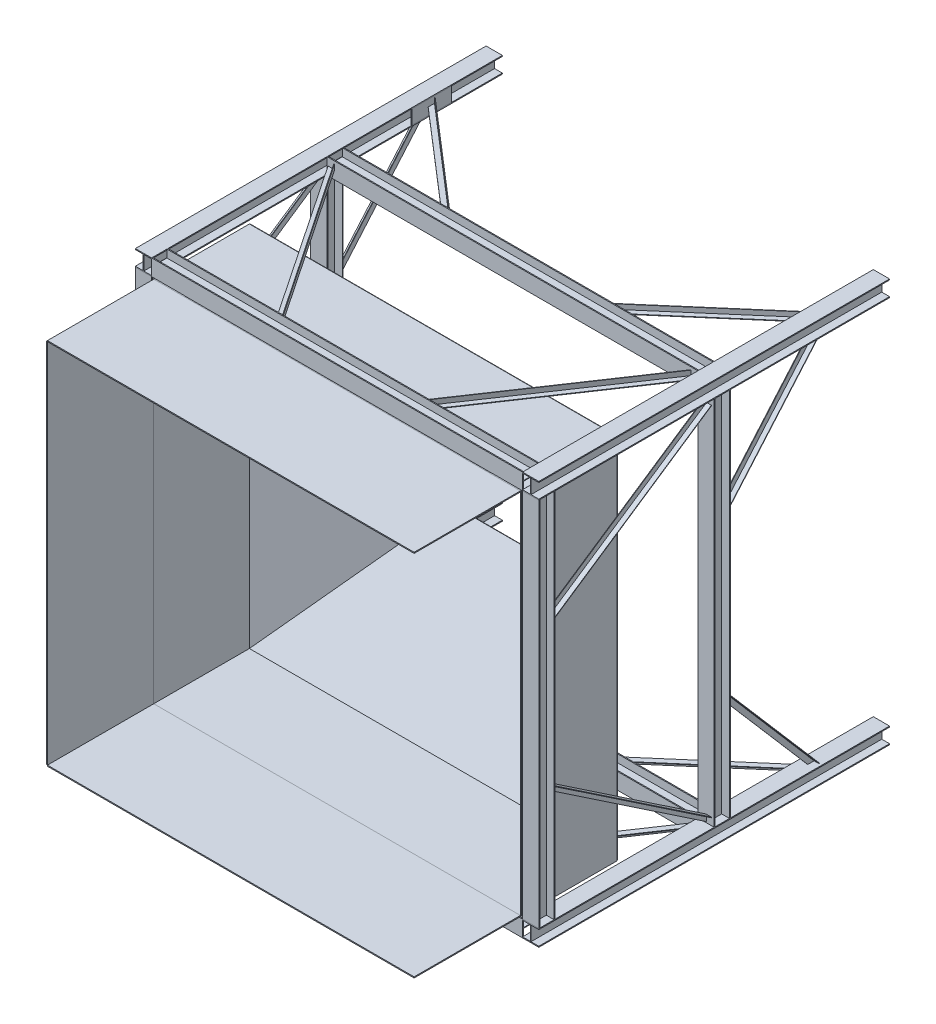
from build123d import *

# Parameters (mm, degrees)
COLUMNA_H_1_DEPTH                            = 3300
COLUMNA_H_2_DEPTH                            = 3300
COLUMNA_H_3_DEPTH                            = 3300
COLUMNA_H_4_DEPTH                            = 3300
VIGA_H_CARGA_1650_DEPTH                      = 3490
VIGA_H_CARGA_3300_DEPTH                      = 3490
CONTORNO_CIERRE_COLUMNA_CARGA_A_W            = 370
CONTORNO_CIERRE_COLUMNA_CARGA_A_H            = 135
CIERRE_COLUMNA_CARGA_A_DEPTH                 = 8
ALA_PLANA_ANGULAR_SUPERIOR_CARGA_A_DEPTH     = 5
RETORNO_ANGULAR_SUPERIOR_CARGA_A_DEPTH       = 45
ALA_PLANA_ANGULAR_INFERIOR_CARGA_A_DEPTH     = 5
RETORNO_ANGULAR_INFERIOR_CARGA_A_DEPTH       = 45
CONTORNO_CIERRE_COLUMNA_CARGA_B_W            = 370
CONTORNO_CIERRE_COLUMNA_CARGA_B_H            = 135
CIERRE_COLUMNA_CARGA_B_DEPTH                 = 8
ALA_PLANA_ANGULAR_SUPERIOR_CARGA_B_DEPTH     = 5
RETORNO_ANGULAR_SUPERIOR_CARGA_B_DEPTH       = 45
ALA_PLANA_ANGULAR_INFERIOR_CARGA_B_DEPTH     = 5
RETORNO_ANGULAR_INFERIOR_CARGA_B_DEPTH       = 45
CONTORNO_ASIENTO_SOLDADO_CARGA_W             = 2900
CONTORNO_ASIENTO_SOLDADO_CARGA_H             = 83.725
ASIENTO_SOLDADO_CARGA_DEPTH                  = 9.525
VIGA_H_FONDO_1650_DEPTH                      = 3490
VIGA_H_FONDO_3300_DEPTH                      = 3490
CONTORNO_CIERRE_COLUMNA_FONDO_A_W            = 370
CONTORNO_CIERRE_COLUMNA_FONDO_A_H            = 135
CIERRE_COLUMNA_FONDO_A_DEPTH                 = 8
ALA_PLANA_ANGULAR_SUPERIOR_FONDO_A_DEPTH     = 5
RETORNO_ANGULAR_SUPERIOR_FONDO_A_DEPTH       = 45
ALA_PLANA_ANGULAR_INFERIOR_FONDO_A_DEPTH     = 5
RETORNO_ANGULAR_INFERIOR_FONDO_A_DEPTH       = 45
CONTORNO_CIERRE_COLUMNA_FONDO_B_W            = 370
CONTORNO_CIERRE_COLUMNA_FONDO_B_H            = 135
CIERRE_COLUMNA_FONDO_B_DEPTH                 = 8
ALA_PLANA_ANGULAR_SUPERIOR_FONDO_B_DEPTH     = 5
RETORNO_ANGULAR_SUPERIOR_FONDO_B_DEPTH       = 45
ALA_PLANA_ANGULAR_INFERIOR_FONDO_B_DEPTH     = 5
RETORNO_ANGULAR_INFERIOR_FONDO_B_DEPTH       = 45
CONTORNO_ASIENTO_SOLDADO_FONDO_W             = 2900
CONTORNO_ASIENTO_SOLDADO_FONDO_H             = 83.725
ASIENTO_SOLDADO_FONDO_DEPTH                  = 9.525
VIGA_H_IZQUIERDA_1650_DEPTH                  = 3490
VIGA_H_IZQUIERDA_3300_DEPTH                  = 3490
ALA_PLANA_ANGULAR_SUPERIOR_IZQUIERDA_A_DEPTH = 5
RETORNO_ANGULAR_SUPERIOR_IZQUIERDA_A_DEPTH   = 45
ALA_PLANA_ANGULAR_INFERIOR_IZQUIERDA_A_DEPTH = 5
RETORNO_ANGULAR_INFERIOR_IZQUIERDA_A_DEPTH   = 45
ALA_PLANA_ANGULAR_SUPERIOR_IZQUIERDA_B_DEPTH = 5
RETORNO_ANGULAR_SUPERIOR_IZQUIERDA_B_DEPTH   = 45
ALA_PLANA_ANGULAR_INFERIOR_IZQUIERDA_B_DEPTH = 5
RETORNO_ANGULAR_INFERIOR_IZQUIERDA_B_DEPTH   = 45
CONTORNO_ASIENTO_SOLDADO_IZQUIERDA_W         = 83.725
CONTORNO_ASIENTO_SOLDADO_IZQUIERDA_H         = 2900
ASIENTO_SOLDADO_IZQUIERDA_DEPTH              = 9.525
VIGA_H_DERECHA_1650_DEPTH                    = 3490
VIGA_H_DERECHA_3300_DEPTH                    = 3490
ALA_PLANA_ANGULAR_SUPERIOR_DERECHA_A_DEPTH   = 5
RETORNO_ANGULAR_SUPERIOR_DERECHA_A_DEPTH     = 45
ALA_PLANA_ANGULAR_INFERIOR_DERECHA_A_DEPTH   = 5
RETORNO_ANGULAR_INFERIOR_DERECHA_A_DEPTH     = 45
ALA_PLANA_ANGULAR_SUPERIOR_DERECHA_B_DEPTH   = 5
RETORNO_ANGULAR_SUPERIOR_DERECHA_B_DEPTH     = 45
ALA_PLANA_ANGULAR_INFERIOR_DERECHA_B_DEPTH   = 5
RETORNO_ANGULAR_INFERIOR_DERECHA_B_DEPTH     = 45
CONTORNO_ASIENTO_SOLDADO_DERECHA_W           = 83.725
CONTORNO_ASIENTO_SOLDADO_DERECHA_H           = 2900
ASIENTO_SOLDADO_DERECHA_DEPTH                = 9.525
CONTORNO_COLLAR_LATERAL_Y_NEGATIVO_W         = 3450
CONTORNO_COLLAR_LATERAL_Y_NEGATIVO_H         = 900
COLLAR_LATERAL_Y_NEGATIVO_DEPTH              = 9.525
CONTORNO_ALER_N_LATERAL_Y_NEGATIVO_W         = 3450
CONTORNO_ALER_N_LATERAL_Y_NEGATIVO_H         = 1000
ALER_N_LATERAL_Y_NEGATIVO_DEPTH              = 9.525
EMBUDO_LATERAL_Y_NEGATIVO_DEPTH              = 9.525
CONTORNO_COLLAR_CARGA_W                      = 900
CONTORNO_COLLAR_CARGA_H                      = 3450
COLLAR_CARGA_DEPTH                           = 9.525
EMBUDO_CARGA_DEPTH                           = 9.525
CONTORNO_COLLAR_LATERAL_Y_POSITIVO_W         = 3450
CONTORNO_COLLAR_LATERAL_Y_POSITIVO_H         = 900
COLLAR_LATERAL_Y_POSITIVO_DEPTH              = 9.525
CONTORNO_ALER_N_LATERAL_Y_POSITIVO_W         = 3450
CONTORNO_ALER_N_LATERAL_Y_POSITIVO_H         = 1000
ALER_N_LATERAL_Y_POSITIVO_DEPTH              = 9.525
EMBUDO_LATERAL_Y_POSITIVO_DEPTH              = 9.525
CONTORNO_COLLAR_FONDO_X_NEGATIVO_W           = 900
CONTORNO_COLLAR_FONDO_X_NEGATIVO_H           = 3450
COLLAR_FONDO_X_NEGATIVO_DEPTH                = 9.525
CONTORNO_ALER_N_FONDO_X_NEGATIVO_W           = 1000
CONTORNO_ALER_N_FONDO_X_NEGATIVO_H           = 3450
ALER_N_FONDO_X_NEGATIVO_DEPTH                = 9.525
EMBUDO_FONDO_X_NEGATIVO_DEPTH                = 9.525


with BuildPart() as part:
    # Contorno Columna H 1 → Columna H 1 (new body)
    with BuildSketch(Plane.XY):
        Polygon((-1898, -1898), (-1745, -1898), (-1745, -1889), (-1818.25, -1889), (-1818.25, -1754), (-1745, -1754), (-1745, -1745), (-1898, -1745), (-1898, -1754), (-1824.75, -1754), (-1824.75, -1889), (-1898, -1889), align=None)
    extrude(amount=COLUMNA_H_1_DEPTH)


with BuildPart() as body_2:
    # Contorno Columna H 2 → Columna H 2 (new body)
    with BuildSketch(Plane.XY):
        Polygon((-1898, 1745), (-1745, 1745), (-1745, 1754), (-1818.25, 1754), (-1818.25, 1889), (-1745, 1889), (-1745, 1898), (-1898, 1898), (-1898, 1889), (-1824.75, 1889), (-1824.75, 1754), (-1898, 1754), align=None)
    extrude(amount=COLUMNA_H_2_DEPTH)


with BuildPart() as body_3:
    # Contorno Columna H 3 → Columna H 3 (new body)
    with BuildSketch(Plane.XY):
        Polygon((1745, -1898), (1898, -1898), (1898, -1889), (1824.75, -1889), (1824.75, -1754), (1898, -1754), (1898, -1745), (1745, -1745), (1745, -1754), (1818.25, -1754), (1818.25, -1889), (1745, -1889), align=None)
    extrude(amount=COLUMNA_H_3_DEPTH)


with BuildPart() as body_4:
    # Contorno Columna H 4 → Columna H 4 (new body)
    with BuildSketch(Plane.XY):
        Polygon((1745, 1745), (1898, 1745), (1898, 1754), (1824.75, 1754), (1824.75, 1889), (1898, 1889), (1898, 1898), (1745, 1898), (1745, 1889), (1818.25, 1889), (1818.25, 1754), (1745, 1754), align=None)
    extrude(amount=COLUMNA_H_4_DEPTH)


with BuildPart() as body_5:
    # Contorno Viga H carga 1650 → Viga H carga 1650 (new body)
    with BuildSketch(Plane(origin=(-1745, 0, 0), x_dir=(0, 0, -1), z_dir=(1, 0, 0))):
        Polygon((-1497, -1745), (-1497, -1898), (-1506, -1898), (-1506, -1824.75), (-1641, -1824.75), (-1641, -1898), (-1650, -1898), (-1650, -1745), (-1641, -1745), (-1641, -1818.25), (-1506, -1818.25), (-1506, -1745), align=None)
    extrude(amount=VIGA_H_CARGA_1650_DEPTH)


with BuildPart() as body_6:
    # Contorno Viga H carga 3300 → Viga H carga 3300 (new body)
    with BuildSketch(Plane(origin=(-1745, 0, 0), x_dir=(0, 0, -1), z_dir=(1, 0, 0))):
        Polygon((-3147, -1745), (-3147, -1898), (-3156, -1898), (-3156, -1824.75), (-3291, -1824.75), (-3291, -1898), (-3300, -1898), (-3300, -1745), (-3291, -1745), (-3291, -1818.25), (-3156, -1818.25), (-3156, -1745), align=None)
    extrude(amount=VIGA_H_CARGA_3300_DEPTH)


with BuildPart() as body_7:
    # Contorno Cierre columna carga A → Cierre columna carga A (new body)
    with BuildSketch(Plane(origin=(-1745, 0, 0), x_dir=(0, 0, -1), z_dir=(1, 0, 0))):
        with Locations((-665, -1821.5)):
            Rectangle(CONTORNO_CIERRE_COLUMNA_CARGA_A_W, CONTORNO_CIERRE_COLUMNA_CARGA_A_H)
    extrude(amount=-CIERRE_COLUMNA_CARGA_A_DEPTH)


with BuildPart() as body_8:
    # Contorno Ala plana Angular superior carg → Ala plana Angular superior carga A (new body)
    with BuildSketch(Plane(origin=(0, -1821.5, 0), x_dir=(1, 0, 0), z_dir=(0, 1, 0))):
        Polygon((-1674.870108064, -1650), (-1735.129891936, -1650), (-728.129891936, -3147), (-667.870108064, -3147), align=None)
    extrude(amount=-ALA_PLANA_ANGULAR_SUPERIOR_CARGA_A_DEPTH)


with BuildPart() as body_9:
    # Contorno Retorno Angular superior carga → Retorno Angular superior carga A (new body)
    with BuildSketch(Plane(origin=(0, -1826.5, 0), x_dir=(1, 0, 0), z_dir=(0, 1, 0))):
        Polygon((-1674.870108064, -1650), (-1680.896086451, -1650), (-673.896086451, -3147), (-667.870108064, -3147), align=None)
    extrude(amount=-RETORNO_ANGULAR_SUPERIOR_CARGA_A_DEPTH)


with BuildPart() as body_8_1:
    add(body_8.part)

    # Angular superior carga A: union body 9
    add(body_9.part)


with BuildPart() as body_9_2:
    # Contorno Ala plana Angular inferior carg → Ala plana Angular inferior carga A (new body)
    with BuildSketch(Plane(origin=(0, -1821.5, 0), x_dir=(1, 0, 0), z_dir=(0, 1, 0))):
        Polygon((-1745, -631.991026401), (-1745, -698.008973599), (-818.285648465, -1497), (-741.714351535, -1497), align=None)
    extrude(amount=-ALA_PLANA_ANGULAR_INFERIOR_CARGA_A_DEPTH)


with BuildPart() as body_10:
    # Contorno Retorno Angular inferior carga → Retorno Angular inferior carga A (new body)
    with BuildSketch(Plane(origin=(0, -1826.5, 0), x_dir=(1, 0, 0), z_dir=(0, 1, 0))):
        Polygon((-1745, -631.991026401), (-1745, -638.592821121), (-749.371481228, -1497), (-741.714351535, -1497), align=None)
    extrude(amount=-RETORNO_ANGULAR_INFERIOR_CARGA_A_DEPTH)


with BuildPart() as body_9_2_1:
    add(body_9_2.part)

    # Angular inferior carga A: union body 10
    add(body_10.part)


with BuildPart() as body_10_2:
    # Contorno Cierre columna carga B → Cierre columna carga B (new body)
    with BuildSketch(Plane(origin=(1745, 0, 0), x_dir=(0, 0, -1), z_dir=(1, 0, 0))):
        with Locations((-665, -1821.5)):
            Rectangle(CONTORNO_CIERRE_COLUMNA_CARGA_B_W, CONTORNO_CIERRE_COLUMNA_CARGA_B_H)
    extrude(amount=CIERRE_COLUMNA_CARGA_B_DEPTH)


with BuildPart() as body_11:
    # Contorno Ala plana Angular superior  2 → Ala plana Angular superior carga B (new body)
    with BuildSketch(Plane(origin=(0, -1821.5, 0), x_dir=(1, 0, 0), z_dir=(0, 1, 0))):
        Polygon((1674.870108064, -1650), (1735.129891936, -1650), (728.129891936, -3147), (667.870108064, -3147), align=None)
    extrude(amount=-ALA_PLANA_ANGULAR_SUPERIOR_CARGA_B_DEPTH)


with BuildPart() as body_12:
    # Contorno Retorno Angular superior ca 2 → Retorno Angular superior carga B (new body)
    with BuildSketch(Plane(origin=(0, -1826.5, 0), x_dir=(1, 0, 0), z_dir=(0, 1, 0))):
        Polygon((1674.870108064, -1650), (1680.896086451, -1650), (673.896086451, -3147), (667.870108064, -3147), align=None)
    extrude(amount=-RETORNO_ANGULAR_SUPERIOR_CARGA_B_DEPTH)


with BuildPart() as body_11_1:
    add(body_11.part)

    # Angular superior carga B: union body 12
    add(body_12.part)


with BuildPart() as body_12_2:
    # Contorno Ala plana Angular inferior  2 → Ala plana Angular inferior carga B (new body)
    with BuildSketch(Plane(origin=(0, -1821.5, 0), x_dir=(1, 0, 0), z_dir=(0, 1, 0))):
        Polygon((1745, -631.991026401), (1745, -698.008973599), (818.285648465, -1497), (741.714351535, -1497), align=None)
    extrude(amount=-ALA_PLANA_ANGULAR_INFERIOR_CARGA_B_DEPTH)


with BuildPart() as body_13:
    # Contorno Retorno Angular inferior ca 2 → Retorno Angular inferior carga B (new body)
    with BuildSketch(Plane(origin=(0, -1826.5, 0), x_dir=(1, 0, 0), z_dir=(0, 1, 0))):
        Polygon((1745, -631.991026401), (1745, -638.592821121), (749.371481228, -1497), (741.714351535, -1497), align=None)
    extrude(amount=-RETORNO_ANGULAR_INFERIOR_CARGA_B_DEPTH)


with BuildPart() as body_12_2_1:
    add(body_12_2.part)

    # Angular inferior carga B: union body 13
    add(body_13.part)


with BuildPart() as body_13_2:
    # Contorno Asiento soldado carga → Asiento soldado carga (new body)
    with BuildSketch(Plane.XY.offset(3281.475)):
        with Locations((0, -1776.3875)):
            Rectangle(CONTORNO_ASIENTO_SOLDADO_CARGA_W, CONTORNO_ASIENTO_SOLDADO_CARGA_H)
    extrude(amount=ASIENTO_SOLDADO_CARGA_DEPTH)


with BuildPart() as body_14:
    # Contorno Viga H fondo 1650 → Viga H fondo 1650 (new body)
    with BuildSketch(Plane(origin=(-1745, 0, 0), x_dir=(0, 0, -1), z_dir=(1, 0, 0))):
        Polygon((-1497, 1745), (-1497, 1898), (-1506, 1898), (-1506, 1824.75), (-1641, 1824.75), (-1641, 1898), (-1650, 1898), (-1650, 1745), (-1641, 1745), (-1641, 1818.25), (-1506, 1818.25), (-1506, 1745), align=None)
    extrude(amount=VIGA_H_FONDO_1650_DEPTH)


with BuildPart() as body_15:
    # Contorno Viga H fondo 3300 → Viga H fondo 3300 (new body)
    with BuildSketch(Plane(origin=(-1745, 0, 0), x_dir=(0, 0, -1), z_dir=(1, 0, 0))):
        Polygon((-3147, 1745), (-3147, 1898), (-3156, 1898), (-3156, 1824.75), (-3291, 1824.75), (-3291, 1898), (-3300, 1898), (-3300, 1745), (-3291, 1745), (-3291, 1818.25), (-3156, 1818.25), (-3156, 1745), align=None)
    extrude(amount=VIGA_H_FONDO_3300_DEPTH)


with BuildPart() as body_16:
    # Contorno Cierre columna fondo A → Cierre columna fondo A (new body)
    with BuildSketch(Plane(origin=(-1745, 0, 0), x_dir=(0, 0, -1), z_dir=(1, 0, 0))):
        with Locations((-665, 1821.5)):
            Rectangle(CONTORNO_CIERRE_COLUMNA_FONDO_A_W, CONTORNO_CIERRE_COLUMNA_FONDO_A_H)
    extrude(amount=-CIERRE_COLUMNA_FONDO_A_DEPTH)


with BuildPart() as body_17:
    # Contorno Ala plana Angular superior fond → Ala plana Angular superior fondo A (new body)
    with BuildSketch(Plane(origin=(0, 1821.5, 0), x_dir=(1, 0, 0), z_dir=(0, 1, 0))):
        Polygon((-1674.870108064, -1650), (-1735.129891936, -1650), (-728.129891936, -3147), (-667.870108064, -3147), align=None)
    extrude(amount=ALA_PLANA_ANGULAR_SUPERIOR_FONDO_A_DEPTH)


with BuildPart() as body_18:
    # Contorno Retorno Angular superior fondo → Retorno Angular superior fondo A (new body)
    with BuildSketch(Plane(origin=(0, 1826.5, 0), x_dir=(1, 0, 0), z_dir=(0, 1, 0))):
        Polygon((-1674.870108064, -1650), (-1680.896086451, -1650), (-673.896086451, -3147), (-667.870108064, -3147), align=None)
    extrude(amount=RETORNO_ANGULAR_SUPERIOR_FONDO_A_DEPTH)


with BuildPart() as body_17_1:
    add(body_17.part)

    # Angular superior fondo A: union body 18
    add(body_18.part)


with BuildPart() as body_18_2:
    # Contorno Ala plana Angular inferior fond → Ala plana Angular inferior fondo A (new body)
    with BuildSketch(Plane(origin=(0, 1821.5, 0), x_dir=(1, 0, 0), z_dir=(0, 1, 0))):
        Polygon((-1745, -631.991026401), (-1745, -698.008973599), (-818.285648465, -1497), (-741.714351535, -1497), align=None)
    extrude(amount=ALA_PLANA_ANGULAR_INFERIOR_FONDO_A_DEPTH)


with BuildPart() as body_19:
    # Contorno Retorno Angular inferior fondo → Retorno Angular inferior fondo A (new body)
    with BuildSketch(Plane(origin=(0, 1826.5, 0), x_dir=(1, 0, 0), z_dir=(0, 1, 0))):
        Polygon((-1745, -631.991026401), (-1745, -638.592821121), (-749.371481228, -1497), (-741.714351535, -1497), align=None)
    extrude(amount=RETORNO_ANGULAR_INFERIOR_FONDO_A_DEPTH)


with BuildPart() as body_18_2_1:
    add(body_18_2.part)

    # Angular inferior fondo A: union body 19
    add(body_19.part)


with BuildPart() as body_19_2:
    # Contorno Cierre columna fondo B → Cierre columna fondo B (new body)
    with BuildSketch(Plane(origin=(1745, 0, 0), x_dir=(0, 0, -1), z_dir=(1, 0, 0))):
        with Locations((-665, 1821.5)):
            Rectangle(CONTORNO_CIERRE_COLUMNA_FONDO_B_W, CONTORNO_CIERRE_COLUMNA_FONDO_B_H)
    extrude(amount=CIERRE_COLUMNA_FONDO_B_DEPTH)


with BuildPart() as body_20:
    # Contorno Ala plana Angular superior  3 → Ala plana Angular superior fondo B (new body)
    with BuildSketch(Plane(origin=(0, 1821.5, 0), x_dir=(1, 0, 0), z_dir=(0, 1, 0))):
        Polygon((1674.870108064, -1650), (1735.129891936, -1650), (728.129891936, -3147), (667.870108064, -3147), align=None)
    extrude(amount=ALA_PLANA_ANGULAR_SUPERIOR_FONDO_B_DEPTH)


with BuildPart() as body_21:
    # Contorno Retorno Angular superior fo 2 → Retorno Angular superior fondo B (new body)
    with BuildSketch(Plane(origin=(0, 1826.5, 0), x_dir=(1, 0, 0), z_dir=(0, 1, 0))):
        Polygon((1674.870108064, -1650), (1680.896086451, -1650), (673.896086451, -3147), (667.870108064, -3147), align=None)
    extrude(amount=RETORNO_ANGULAR_SUPERIOR_FONDO_B_DEPTH)


with BuildPart() as body_20_1:
    add(body_20.part)

    # Angular superior fondo B: union body 21
    add(body_21.part)


with BuildPart() as body_21_2:
    # Contorno Ala plana Angular inferior  3 → Ala plana Angular inferior fondo B (new body)
    with BuildSketch(Plane(origin=(0, 1821.5, 0), x_dir=(1, 0, 0), z_dir=(0, 1, 0))):
        Polygon((1745, -631.991026401), (1745, -698.008973599), (818.285648465, -1497), (741.714351535, -1497), align=None)
    extrude(amount=ALA_PLANA_ANGULAR_INFERIOR_FONDO_B_DEPTH)


with BuildPart() as body_22:
    # Contorno Retorno Angular inferior fo 2 → Retorno Angular inferior fondo B (new body)
    with BuildSketch(Plane(origin=(0, 1826.5, 0), x_dir=(1, 0, 0), z_dir=(0, 1, 0))):
        Polygon((1745, -631.991026401), (1745, -638.592821121), (749.371481228, -1497), (741.714351535, -1497), align=None)
    extrude(amount=RETORNO_ANGULAR_INFERIOR_FONDO_B_DEPTH)


with BuildPart() as body_21_2_1:
    add(body_21_2.part)

    # Angular inferior fondo B: union body 22
    add(body_22.part)


with BuildPart() as body_22_2:
    # Contorno Asiento soldado fondo → Asiento soldado fondo (new body)
    with BuildSketch(Plane.XY.offset(3281.475)):
        with Locations((0, 1776.3875)):
            Rectangle(CONTORNO_ASIENTO_SOLDADO_FONDO_W, CONTORNO_ASIENTO_SOLDADO_FONDO_H)
    extrude(amount=ASIENTO_SOLDADO_FONDO_DEPTH)


with BuildPart() as body_23:
    # Contorno Viga H izquierda 1650 → Viga H izquierda 1650 (new body)
    with BuildSketch(Plane(origin=(0, -1745, 0), x_dir=(1, 0, 0), z_dir=(0, 1, 0))):
        Polygon((-1745, -1497), (-1898, -1497), (-1898, -1506), (-1824.75, -1506), (-1824.75, -1641), (-1898, -1641), (-1898, -1650), (-1745, -1650), (-1745, -1641), (-1818.25, -1641), (-1818.25, -1506), (-1745, -1506), align=None)
    extrude(amount=VIGA_H_IZQUIERDA_1650_DEPTH)


with BuildPart() as body_24:
    # Contorno Viga H izquierda 3300 → Viga H izquierda 3300 (new body)
    with BuildSketch(Plane(origin=(0, -1745, 0), x_dir=(1, 0, 0), z_dir=(0, 1, 0))):
        Polygon((-1745, -3147), (-1898, -3147), (-1898, -3156), (-1824.75, -3156), (-1824.75, -3291), (-1898, -3291), (-1898, -3300), (-1745, -3300), (-1745, -3291), (-1818.25, -3291), (-1818.25, -3156), (-1745, -3156), align=None)
    extrude(amount=VIGA_H_IZQUIERDA_3300_DEPTH)


with BuildPart() as body_25:
    # Contorno Ala plana Angular superior izqu → Ala plana Angular superior izquierda A (new body)
    with BuildSketch(Plane(origin=(-1821.5, 0, 0), x_dir=(0, 0, -1), z_dir=(1, 0, 0))):
        Polygon((-1650, -1674.870108064), (-1650, -1735.129891936), (-3147, -728.129891936), (-3147, -667.870108064), align=None)
    extrude(amount=-ALA_PLANA_ANGULAR_SUPERIOR_IZQUIERDA_A_DEPTH)


with BuildPart() as body_26:
    # Contorno Retorno Angular superior izquie → Retorno Angular superior izquierda A (new body)
    with BuildSketch(Plane(origin=(-1826.5, 0, 0), x_dir=(0, 0, -1), z_dir=(1, 0, 0))):
        Polygon((-1650, -1674.870108064), (-1650, -1680.896086451), (-3147, -673.896086451), (-3147, -667.870108064), align=None)
    extrude(amount=-RETORNO_ANGULAR_SUPERIOR_IZQUIERDA_A_DEPTH)


with BuildPart() as body_25_1:
    add(body_25.part)

    # Angular superior izquierda A: union body 26
    add(body_26.part)


with BuildPart() as body_26_2:
    # Contorno Ala plana Angular inferior izqu → Ala plana Angular inferior izquierda A (new body)
    with BuildSketch(Plane(origin=(-1821.5, 0, 0), x_dir=(0, 0, -1), z_dir=(1, 0, 0))):
        Polygon((-631.991026401, -1745), (-698.008973599, -1745), (-1497, -818.285648465), (-1497, -741.714351535), align=None)
    extrude(amount=-ALA_PLANA_ANGULAR_INFERIOR_IZQUIERDA_A_DEPTH)


with BuildPart() as body_27:
    # Contorno Retorno Angular inferior izquie → Retorno Angular inferior izquierda A (new body)
    with BuildSketch(Plane(origin=(-1826.5, 0, 0), x_dir=(0, 0, -1), z_dir=(1, 0, 0))):
        Polygon((-631.991026401, -1745), (-638.592821121, -1745), (-1497, -749.371481228), (-1497, -741.714351535), align=None)
    extrude(amount=-RETORNO_ANGULAR_INFERIOR_IZQUIERDA_A_DEPTH)


with BuildPart() as body_26_2_1:
    add(body_26_2.part)

    # Angular inferior izquierda A: union body 27
    add(body_27.part)


with BuildPart() as body_27_2:
    # Contorno Ala plana Angular superior  4 → Ala plana Angular superior izquierda B (new body)
    with BuildSketch(Plane(origin=(-1821.5, 0, 0), x_dir=(0, 0, -1), z_dir=(1, 0, 0))):
        Polygon((-1650, 1674.870108064), (-1650, 1735.129891936), (-3147, 728.129891936), (-3147, 667.870108064), align=None)
    extrude(amount=-ALA_PLANA_ANGULAR_SUPERIOR_IZQUIERDA_B_DEPTH)


with BuildPart() as body_28:
    # Contorno Retorno Angular superior iz 2 → Retorno Angular superior izquierda B (new body)
    with BuildSketch(Plane(origin=(-1826.5, 0, 0), x_dir=(0, 0, -1), z_dir=(1, 0, 0))):
        Polygon((-1650, 1674.870108064), (-1650, 1680.896086451), (-3147, 673.896086451), (-3147, 667.870108064), align=None)
    extrude(amount=-RETORNO_ANGULAR_SUPERIOR_IZQUIERDA_B_DEPTH)


with BuildPart() as body_27_2_1:
    add(body_27_2.part)

    # Angular superior izquierda B: union body 28
    add(body_28.part)


with BuildPart() as body_28_2:
    # Contorno Ala plana Angular inferior  4 → Ala plana Angular inferior izquierda B (new body)
    with BuildSketch(Plane(origin=(-1821.5, 0, 0), x_dir=(0, 0, -1), z_dir=(1, 0, 0))):
        Polygon((-631.991026401, 1745), (-698.008973599, 1745), (-1497, 818.285648465), (-1497, 741.714351535), align=None)
    extrude(amount=-ALA_PLANA_ANGULAR_INFERIOR_IZQUIERDA_B_DEPTH)


with BuildPart() as body_29:
    # Contorno Retorno Angular inferior iz 2 → Retorno Angular inferior izquierda B (new body)
    with BuildSketch(Plane(origin=(-1826.5, 0, 0), x_dir=(0, 0, -1), z_dir=(1, 0, 0))):
        Polygon((-631.991026401, 1745), (-638.592821121, 1745), (-1497, 749.371481228), (-1497, 741.714351535), align=None)
    extrude(amount=-RETORNO_ANGULAR_INFERIOR_IZQUIERDA_B_DEPTH)


with BuildPart() as body_28_2_1:
    add(body_28_2.part)

    # Angular inferior izquierda B: union body 29
    add(body_29.part)


with BuildPart() as body_29_2:
    # Contorno Asiento soldado izquierda → Asiento soldado izquierda (new body)
    with BuildSketch(Plane.XY.offset(3281.475)):
        with Locations((-1776.3875, 0)):
            Rectangle(CONTORNO_ASIENTO_SOLDADO_IZQUIERDA_W, CONTORNO_ASIENTO_SOLDADO_IZQUIERDA_H)
    extrude(amount=ASIENTO_SOLDADO_IZQUIERDA_DEPTH)


with BuildPart() as body_30:
    # Contorno Viga H derecha 1650 → Viga H derecha 1650 (new body)
    with BuildSketch(Plane(origin=(0, -1745, 0), x_dir=(1, 0, 0), z_dir=(0, 1, 0))):
        Polygon((1745, -1497), (1898, -1497), (1898, -1506), (1824.75, -1506), (1824.75, -1641), (1898, -1641), (1898, -1650), (1745, -1650), (1745, -1641), (1818.25, -1641), (1818.25, -1506), (1745, -1506), align=None)
    extrude(amount=VIGA_H_DERECHA_1650_DEPTH)


with BuildPart() as body_31:
    # Contorno Viga H derecha 3300 → Viga H derecha 3300 (new body)
    with BuildSketch(Plane(origin=(0, -1745, 0), x_dir=(1, 0, 0), z_dir=(0, 1, 0))):
        Polygon((1745, -3147), (1898, -3147), (1898, -3156), (1824.75, -3156), (1824.75, -3291), (1898, -3291), (1898, -3300), (1745, -3300), (1745, -3291), (1818.25, -3291), (1818.25, -3156), (1745, -3156), align=None)
    extrude(amount=VIGA_H_DERECHA_3300_DEPTH)


with BuildPart() as body_32:
    # Contorno Ala plana Angular superior dere → Ala plana Angular superior derecha A (new body)
    with BuildSketch(Plane(origin=(1821.5, 0, 0), x_dir=(0, 0, -1), z_dir=(1, 0, 0))):
        Polygon((-1650, -1674.870108064), (-1650, -1735.129891936), (-3147, -728.129891936), (-3147, -667.870108064), align=None)
    extrude(amount=ALA_PLANA_ANGULAR_SUPERIOR_DERECHA_A_DEPTH)


with BuildPart() as body_33:
    # Contorno Retorno Angular superior derech → Retorno Angular superior derecha A (new body)
    with BuildSketch(Plane(origin=(1826.5, 0, 0), x_dir=(0, 0, -1), z_dir=(1, 0, 0))):
        Polygon((-1650, -1674.870108064), (-1650, -1680.896086451), (-3147, -673.896086451), (-3147, -667.870108064), align=None)
    extrude(amount=RETORNO_ANGULAR_SUPERIOR_DERECHA_A_DEPTH)


with BuildPart() as body_32_1:
    add(body_32.part)

    # Angular superior derecha A: union body 33
    add(body_33.part)


with BuildPart() as body_33_2:
    # Contorno Ala plana Angular inferior dere → Ala plana Angular inferior derecha A (new body)
    with BuildSketch(Plane(origin=(1821.5, 0, 0), x_dir=(0, 0, -1), z_dir=(1, 0, 0))):
        Polygon((-631.991026401, -1745), (-698.008973599, -1745), (-1497, -818.285648465), (-1497, -741.714351535), align=None)
    extrude(amount=ALA_PLANA_ANGULAR_INFERIOR_DERECHA_A_DEPTH)


with BuildPart() as body_34:
    # Contorno Retorno Angular inferior derech → Retorno Angular inferior derecha A (new body)
    with BuildSketch(Plane(origin=(1826.5, 0, 0), x_dir=(0, 0, -1), z_dir=(1, 0, 0))):
        Polygon((-631.991026401, -1745), (-638.592821121, -1745), (-1497, -749.371481228), (-1497, -741.714351535), align=None)
    extrude(amount=RETORNO_ANGULAR_INFERIOR_DERECHA_A_DEPTH)


with BuildPart() as body_33_2_1:
    add(body_33_2.part)

    # Angular inferior derecha A: union body 34
    add(body_34.part)


with BuildPart() as body_34_2:
    # Contorno Ala plana Angular superior  5 → Ala plana Angular superior derecha B (new body)
    with BuildSketch(Plane(origin=(1821.5, 0, 0), x_dir=(0, 0, -1), z_dir=(1, 0, 0))):
        Polygon((-1650, 1674.870108064), (-1650, 1735.129891936), (-3147, 728.129891936), (-3147, 667.870108064), align=None)
    extrude(amount=ALA_PLANA_ANGULAR_SUPERIOR_DERECHA_B_DEPTH)


with BuildPart() as body_35:
    # Contorno Retorno Angular superior de 2 → Retorno Angular superior derecha B (new body)
    with BuildSketch(Plane(origin=(1826.5, 0, 0), x_dir=(0, 0, -1), z_dir=(1, 0, 0))):
        Polygon((-1650, 1674.870108064), (-1650, 1680.896086451), (-3147, 673.896086451), (-3147, 667.870108064), align=None)
    extrude(amount=RETORNO_ANGULAR_SUPERIOR_DERECHA_B_DEPTH)


with BuildPart() as body_34_2_1:
    add(body_34_2.part)

    # Angular superior derecha B: union body 35
    add(body_35.part)


with BuildPart() as body_35_2:
    # Contorno Ala plana Angular inferior  5 → Ala plana Angular inferior derecha B (new body)
    with BuildSketch(Plane(origin=(1821.5, 0, 0), x_dir=(0, 0, -1), z_dir=(1, 0, 0))):
        Polygon((-631.991026401, 1745), (-698.008973599, 1745), (-1497, 818.285648465), (-1497, 741.714351535), align=None)
    extrude(amount=ALA_PLANA_ANGULAR_INFERIOR_DERECHA_B_DEPTH)


with BuildPart() as body_36:
    # Contorno Retorno Angular inferior de 2 → Retorno Angular inferior derecha B (new body)
    with BuildSketch(Plane(origin=(1826.5, 0, 0), x_dir=(0, 0, -1), z_dir=(1, 0, 0))):
        Polygon((-631.991026401, 1745), (-638.592821121, 1745), (-1497, 749.371481228), (-1497, 741.714351535), align=None)
    extrude(amount=RETORNO_ANGULAR_INFERIOR_DERECHA_B_DEPTH)


with BuildPart() as body_35_2_1:
    add(body_35_2.part)

    # Angular inferior derecha B: union body 36
    add(body_36.part)


with BuildPart() as body_36_2:
    # Contorno Asiento soldado derecha → Asiento soldado derecha (new body)
    with BuildSketch(Plane.XY.offset(3281.475)):
        with Locations((1776.3875, 0)):
            Rectangle(CONTORNO_ASIENTO_SOLDADO_DERECHA_W, CONTORNO_ASIENTO_SOLDADO_DERECHA_H)
    extrude(amount=ASIENTO_SOLDADO_DERECHA_DEPTH)


with BuildPart() as body_37:
    # Contorno Collar lateral Y negativo → Collar lateral Y negativo (new body)
    with BuildSketch(Plane(origin=(0, -1725, 0), x_dir=(1, 0, 0), z_dir=(0, 1, 0))):
        with Locations((0, -2850)):
            Rectangle(CONTORNO_COLLAR_LATERAL_Y_NEGATIVO_W, CONTORNO_COLLAR_LATERAL_Y_NEGATIVO_H)
    extrude(amount=-COLLAR_LATERAL_Y_NEGATIVO_DEPTH)


with BuildPart() as body_38:
    # Contorno Alerón lateral Y negativo → Alerón lateral Y negativo (new body)
    with BuildSketch(Plane(origin=(0, -1725, 0), x_dir=(1, 0, 0), z_dir=(0, 1, 0))):
        with Locations((0, -3800)):
            Rectangle(CONTORNO_ALER_N_LATERAL_Y_NEGATIVO_W, CONTORNO_ALER_N_LATERAL_Y_NEGATIVO_H)
    extrude(amount=-ALER_N_LATERAL_Y_NEGATIVO_DEPTH)


with BuildPart() as body_39:
    # Contorno Embudo lateral Y negativo → Embudo lateral Y negativo (new body)
    with BuildSketch(Plane(origin=(0, 601.095747456, 995.564831724), x_dir=(1, 0, 0), z_dir=(0, 0.5168690990339176, 0.8560644452749256))):
        Polygon((-1725, -2717.197005781), (1725, -2717.197005781), (600, -1169.416336564), (-600, -1169.416336564), align=None)
    extrude(amount=-EMBUDO_LATERAL_Y_NEGATIVO_DEPTH)


with BuildPart() as body_40:
    # Contorno Collar carga → Collar carga (new body)
    with BuildSketch(Plane(origin=(1725, 0, 0), x_dir=(0, 0, -1), z_dir=(1, 0, 0))):
        with Locations((-2850, 0)):
            Rectangle(CONTORNO_COLLAR_CARGA_W, CONTORNO_COLLAR_CARGA_H)
    extrude(amount=COLLAR_CARGA_DEPTH)


with BuildPart() as body_41:
    # Contorno Embudo carga → Embudo carga (new body)
    with BuildSketch(Plane(origin=(-554.148901279, 0, 779.271892424), x_dir=(-0.814955324568755, 0, -0.5795237863600037), z_dir=(0.5795237863600037, 0, -0.814955324568755))):
        Polygon((-2796.655022145, -1725), (-2796.655022145, 1725), (-1416.211252917, 400), (-1416.211252917, -400), align=None)
    extrude(amount=EMBUDO_CARGA_DEPTH)


with BuildPart() as body_42:
    # Contorno Collar lateral Y positivo → Collar lateral Y positivo (new body)
    with BuildSketch(Plane(origin=(0, 1725, 0), x_dir=(1, 0, 0), z_dir=(0, 1, 0))):
        with Locations((0, -2850)):
            Rectangle(CONTORNO_COLLAR_LATERAL_Y_POSITIVO_W, CONTORNO_COLLAR_LATERAL_Y_POSITIVO_H)
    extrude(amount=COLLAR_LATERAL_Y_POSITIVO_DEPTH)


with BuildPart() as body_43:
    # Contorno Alerón lateral Y positivo → Alerón lateral Y positivo (new body)
    with BuildSketch(Plane(origin=(0, 1725, 0), x_dir=(1, 0, 0), z_dir=(0, 1, 0))):
        with Locations((0, -3800)):
            Rectangle(CONTORNO_ALER_N_LATERAL_Y_POSITIVO_W, CONTORNO_ALER_N_LATERAL_Y_POSITIVO_H)
    extrude(amount=ALER_N_LATERAL_Y_POSITIVO_DEPTH)


with BuildPart() as body_44:
    # Contorno Embudo lateral Y positivo → Embudo lateral Y positivo (new body)
    with BuildSketch(Plane(origin=(0, -601.095747456, 995.564831724), x_dir=(-1, 0, 0), z_dir=(0, 0.5168690990339176, -0.8560644452749256))):
        Polygon((-1725, 2717.197005781), (1725, 2717.197005781), (600, 1169.416336564), (-600, 1169.416336564), align=None)
    extrude(amount=EMBUDO_LATERAL_Y_POSITIVO_DEPTH)


with BuildPart() as body_45:
    # Contorno Collar fondo X negativo → Collar fondo X negativo (new body)
    with BuildSketch(Plane(origin=(-1725, 0, 0), x_dir=(0, 0, -1), z_dir=(1, 0, 0))):
        with Locations((-2850, 0)):
            Rectangle(CONTORNO_COLLAR_FONDO_X_NEGATIVO_W, CONTORNO_COLLAR_FONDO_X_NEGATIVO_H)
    extrude(amount=-COLLAR_FONDO_X_NEGATIVO_DEPTH)


with BuildPart() as body_46:
    # Contorno Alerón fondo X negativo → Alerón fondo X negativo (new body)
    with BuildSketch(Plane(origin=(-1725, 0, 0), x_dir=(0, 0, -1), z_dir=(1, 0, 0))):
        with Locations((-3800, 0)):
            Rectangle(CONTORNO_ALER_N_FONDO_X_NEGATIVO_W, CONTORNO_ALER_N_FONDO_X_NEGATIVO_H)
    extrude(amount=-ALER_N_FONDO_X_NEGATIVO_DEPTH)


with BuildPart() as body_47:
    # Contorno Embudo fondo X negativo → Embudo fondo X negativo (new body)
    with BuildSketch(Plane(origin=(554.148901279, 0, 779.271892424), x_dir=(0.8149553245687554, 0, -0.5795237863600032), z_dir=(0.5795237863600031, 0, 0.8149553245687553))):
        Polygon((-2796.655022145, 1725), (-2796.655022145, -1725), (-1416.211252917, -400), (-1416.211252917, 400), align=None)
    extrude(amount=-EMBUDO_FONDO_X_NEGATIVO_DEPTH)


solid = Compound([part.part, body_2.part, body_3.part, body_4.part, body_5.part, body_6.part, body_7.part, body_8_1.part, body_9_2_1.part, body_10_2.part, body_11_1.part, body_12_2_1.part, body_13_2.part, body_14.part, body_15.part, body_16.part, body_17_1.part, body_18_2_1.part, body_19_2.part, body_20_1.part, body_21_2_1.part, body_22_2.part, body_23.part, body_24.part, body_25_1.part, body_26_2_1.part, body_27_2_1.part, body_28_2_1.part, body_29_2.part, body_30.part, body_31.part, body_32_1.part, body_33_2_1.part, body_34_2_1.part, body_35_2_1.part, body_36_2.part, body_37.part, body_38.part, body_39.part, body_40.part, body_41.part, body_42.part, body_43.part, body_44.part, body_45.part, body_46.part, body_47.part])
